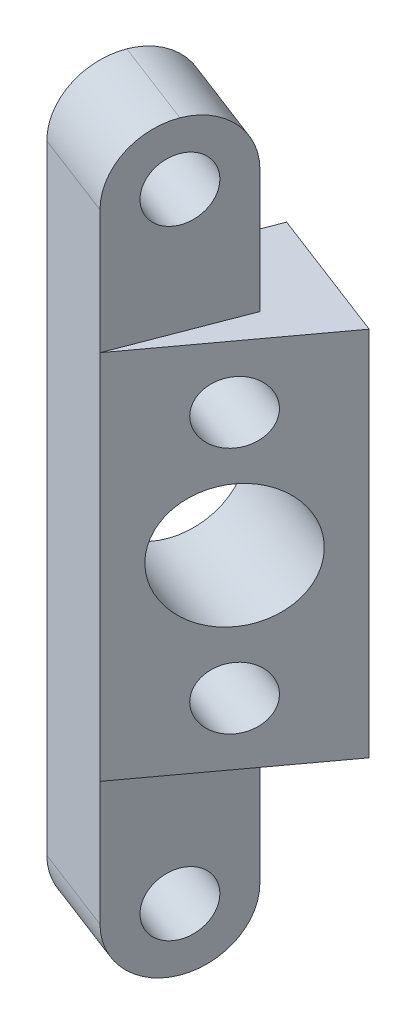
from build123d import *

# Parameters (mm, degrees)
BOSS_EXTRUDE1_DEPTH  = 15
CUT_EXTRUDE1_DEPTH   = 43.992404265
SKETCH3_R            = 5
CUT_EXTRUDE2_DEPTH   = 36.004455062
SKETCH5_W            = 10.737519515
SKETCH5_H            = 30
SKETCH5_W_2          = 6.95
CUT_EXTRUDE3_DEPTH   = 36.004455062
SKETCH7_R            = 2.5
CUT_EXTRUDE4_DEPTH   = 24.248431868
BOSS_EXTRUDE4_DEPTH  = 15
SKETCH9_R            = 2.5
CUT_EXTRUDE5_DEPTH   = 15
FILLET1_R            = 5
FILLET1_OF_MIRROR1_R = 5


with BuildPart() as part:
    # Sketch1 → Boss-Extrude1 (new, symmetric)
    with BuildSketch(Plane(origin=(0, 0, 0), x_dir=(1, 0, 0), z_dir=(0, 1, 0))):
        Polygon((-9.48841315, -9.301961234), (-0.940151386, -8.006660352), (17.861436312, 17.510450435), (15.605946265, 22.576364023), (9.067678571, 25.086169843), (2.607936691, 22.210107458), align=None)
    extrude(amount=BOSS_EXTRUDE1_DEPTH, both=True)

    # Sketch2 → Cut-Extrude1 (cut, through all)
    with BuildSketch(Plane.XZ.offset(15)):
        Polygon((-9.48841315, 9.301961234), (2.607936691, -22.210107458), (9.067678571, -25.086169843), (15.605946265, -22.576364023), (17.861436312, -17.510450435), (-0.940151386, 8.006660352), align=None)
        Polygon((-8.713652873, 8.678855764), (3.000506472, -21.837572646), (9.081845433, -24.545159197), (15.233411453, -22.183794243), (17.286339277, -17.572842857), (-1.219829574, 7.543331818), align=None, mode=Mode.SUBTRACT)
    extrude(amount=-CUT_EXTRUDE1_DEPTH, mode=Mode.SUBTRACT)

    # Sketch3 → Cut-Extrude2 (cut, through all)
    with BuildSketch(Plane(origin=(-4.690935448, 0, -1.800681409), x_dir=(-0.3583679495453122, 0, 0.9335804264971972), z_dir=(-0.9335804264971972, 0, -0.3583679495453122))):
        with Locations((-3.224896221, 0)):
            Circle(SKETCH3_R)
    extrude(amount=-CUT_EXTRUDE2_DEPTH, mode=Mode.SUBTRACT)

    # Sketch5 → Cut-Extrude3 (cut, through all)
    with BuildSketch(Plane(origin=(-4.690935448, 0, -1.800681409), x_dir=(-0.35836794954531215, 0, 0.9335804264971973), z_dir=(-0.9335804264971973, 0, -0.35836794954531215))):
        with Locations((-16.093655978, 0)):
            Rectangle(SKETCH5_W, SKETCH5_H)
        with Locations((7.750103779, 0)):
            Rectangle(SKETCH5_W_2, SKETCH5_H)
    extrude(amount=-CUT_EXTRUDE3_DEPTH, mode=Mode.SUBTRACT)


with BuildPart() as cut_extrude3_kept_piece:
    # of the separate pieces the step leaves, the one the design keeps (cut_extrude3_pieces_kept)
    add(part.part.solids().sort_by_distance((-6.222995624, -15, 2.1904718))[0])

    # Sketch7 → Cut-Extrude4 (cut, through all)
    with BuildSketch(Plane(origin=(-4.690935448, 0, -1.800681409), x_dir=(-0.35836794954531215, 0, 0.9335804264971973), z_dir=(-0.9335804264971973, 0, -0.35836794954531215))):
        with Locations((-3.224896221, 10)):
            Circle(SKETCH7_R)
        with Locations((-3.224896221, -10)):
            Circle(SKETCH7_R)
    extrude(amount=-CUT_EXTRUDE4_DEPTH, mode=Mode.SUBTRACT)

    # Sketch8 → Boss-Extrude4 (add)
    with BuildSketch(Plane(origin=(0, 15, 0), x_dir=(1, 0, 0), z_dir=(0, 1, 0))):
        Polygon((-2.639316128, 7.145332465), (-6.222995624, -2.1904718), (0.751589516, -4.867764195), (4.335269011, 4.46804007), align=None)
    boss_extrude4 = extrude(amount=BOSS_EXTRUDE4_DEPTH)

    # Sketch9 → Cut-Extrude5 (cut)
    with BuildSketch(Plane(origin=(2.283649691, 0, 0.876610985), x_dir=(0.3583679495453119, 0, -0.9335804264971973), z_dir=(0.9335804264971973, 0, 0.3583679495453119))):
        with Locations((0.724896221, 25)):
            Circle(SKETCH9_R)
    cut_extrude5 = extrude(amount=-CUT_EXTRUDE5_DEPTH, mode=Mode.SUBTRACT)

    # Fillet1
    fillet1_edges = [cut_extrude3_kept_piece.edges().sort_by_distance(p)[0] for p in [
        (-2.735703054, 30, 3.529117997),
        (0.847976442, 30, -5.806686268),
    ]]
    fillet(fillet1_edges, radius=FILLET1_R - 0.0001)  # a hair under: the kernel refuses the full size

    # Mirror1: Boss-Extrude4, Cut-Extrude5 across plane
    add(boss_extrude4.mirror(Plane.ZX))
    add(cut_extrude5.mirror(Plane.ZX), mode=Mode.SUBTRACT)

    # Fillet1 of Mirror1
    fillet1_of_mirror1_edges = [cut_extrude3_kept_piece.edges().sort_by_distance(p)[0] for p in [
        (-2.735703054, -30, 3.529117997),
        (0.847976442, -30, -5.806686268),
    ]]
    fillet(fillet1_of_mirror1_edges, radius=FILLET1_OF_MIRROR1_R - 0.0001)  # a hair under: the kernel refuses the full size


solid = cut_extrude3_kept_piece.part
